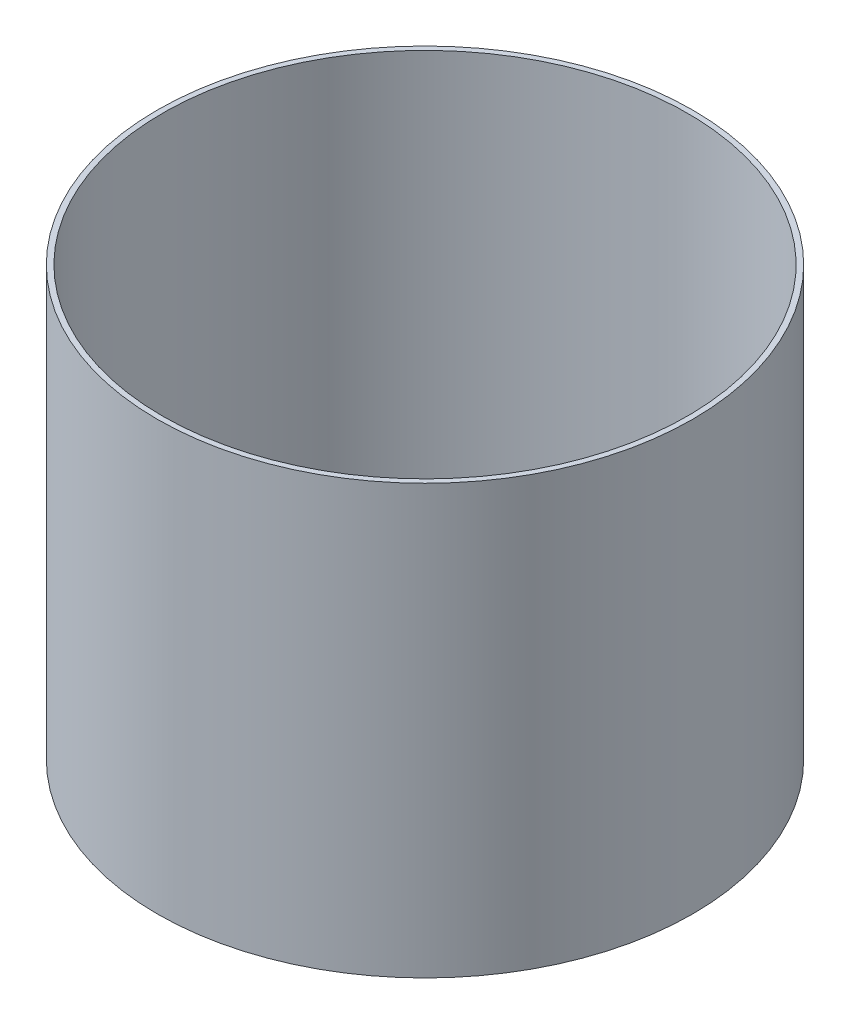
from build123d import *

# Parameters (mm, degrees)
SKETCH1_R           = 127
BOSS_EXTRUDE1_DEPTH = 203.2
SHELL1_T            = -2.54


with BuildPart() as part:
    # Sketch1 → Boss-Extrude1 (new body)
    with BuildSketch(Plane(origin=(0, 0, 0), x_dir=(1, 0, 0), z_dir=(0, 1, 0))):
        Circle(SKETCH1_R)
    extrude(amount=BOSS_EXTRUDE1_DEPTH)

    # Shell1
    shell1_openings = [part.faces().sort_by_distance(p)[0] for p in [
        (0, 203.2, 0),
    ]]
    offset(amount=SHELL1_T, openings=shell1_openings, kind=Kind.INTERSECTION)


solid = part.part
